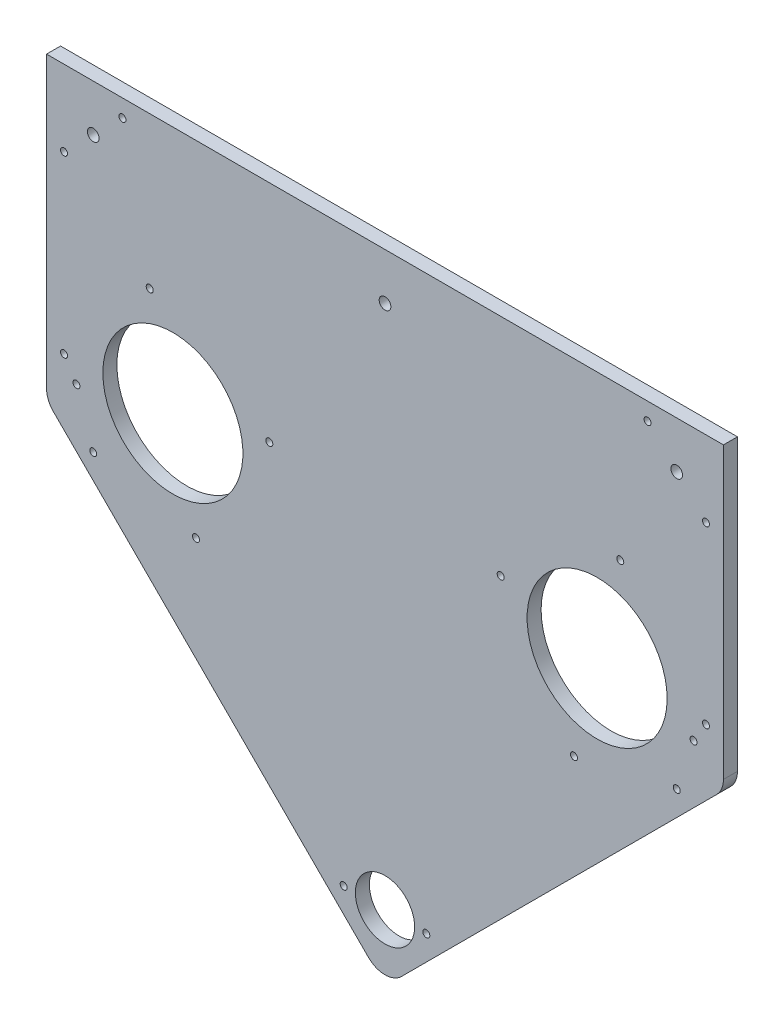
from build123d import *

# Parameters (mm, degrees)
SKETCH1_R           = 12.7
SKETCH1_R_2         = 1.5
SKETCH1_R_3         = 2.5
BOSS_EXTRUDE1_DEPTH = 6
FILLET1_R           = 10
SKETCH2_R           = 1.5
SKETCH2_R_2         = 30
CUT_EXTRUDE1_DEPTH  = 10


with BuildPart() as part:
    # Sketch1 → Boss-Extrude1 (new body)
    with BuildSketch(Plane.XY):
        Polygon((-145, 120), (145, 120), (145, -8.284271247), (0, -153.284271247), (-145, -8.284271247), align=None)
        with Locations((0, -125)):
            Circle(SKETCH1_R, mode=Mode.SUBTRACT)
        with Locations((-137.515790027, 87.484209973)):
            Circle(SKETCH1_R_2, mode=Mode.SUBTRACT)
        with Locations((-112.484209973, 112.515790027)):
            Circle(SKETCH1_R_2, mode=Mode.SUBTRACT)
        with Locations((-137.515790027, 12.515790027)):
            Circle(SKETCH1_R_2, mode=Mode.SUBTRACT)
        with Locations((-125, -17.7)):
            Circle(SKETCH1_R_2, mode=Mode.SUBTRACT)
        with Locations((-17.7, -125)):
            Circle(SKETCH1_R_2, mode=Mode.SUBTRACT)
        with Locations((17.7, -125)):
            Circle(SKETCH1_R_2, mode=Mode.SUBTRACT)
        with Locations((125, -17.7)):
            Circle(SKETCH1_R_2, mode=Mode.SUBTRACT)
        with Locations((137.515790027, 12.515790027)):
            Circle(SKETCH1_R_2, mode=Mode.SUBTRACT)
        with Locations((137.515790027, 87.484209973)):
            Circle(SKETCH1_R_2, mode=Mode.SUBTRACT)
        with Locations((112.484209973, 112.515790027)):
            Circle(SKETCH1_R_2, mode=Mode.SUBTRACT)
        with Locations((0, 100)):
            Circle(SKETCH1_R_3, mode=Mode.SUBTRACT)
        with Locations((-125, 100)):
            Circle(SKETCH1_R_3, mode=Mode.SUBTRACT)
        with Locations((125, 100)):
            Circle(SKETCH1_R_3, mode=Mode.SUBTRACT)
    extrude(amount=BOSS_EXTRUDE1_DEPTH)

    # Fillet1
    fillet1_edges = [part.edges().sort_by_distance(p)[0] for p in [
        (-145, -8.284271247, 3),
        (145, -8.284271247, 3),
        (0, -153.284271247, 3),
    ]]
    fillet(fillet1_edges, radius=FILLET1_R)

    # Sketch2 → Cut-Extrude1 (cut)
    with BuildSketch(Plane.XY.offset(6)):
        with Locations((49.555354063, 23.709258675)):
            Circle(SKETCH2_R)
        with Locations((100.801698291, 55.114866507)):
            Circle(SKETCH2_R)
        with Locations((132.207306124, 3.86852228)):
            Circle(SKETCH2_R)
        with Locations((80.960961896, -27.537085553)):
            Circle(SKETCH2_R)
        with Locations((90.881330093, 13.788890477)):
            Circle(SKETCH2_R_2)
        with Locations((-49.555354063, 23.709258675)):
            Circle(SKETCH2_R)
        with Locations((-100.801698291, 55.114866507)):
            Circle(SKETCH2_R)
        with Locations((-80.960961896, -27.537085553)):
            Circle(SKETCH2_R)
        with Locations((-132.207306124, 3.86852228)):
            Circle(SKETCH2_R)
        with Locations((-90.881330093, 13.788890477)):
            Circle(SKETCH2_R_2)
    extrude(amount=-CUT_EXTRUDE1_DEPTH, mode=Mode.SUBTRACT)


solid = part.part
